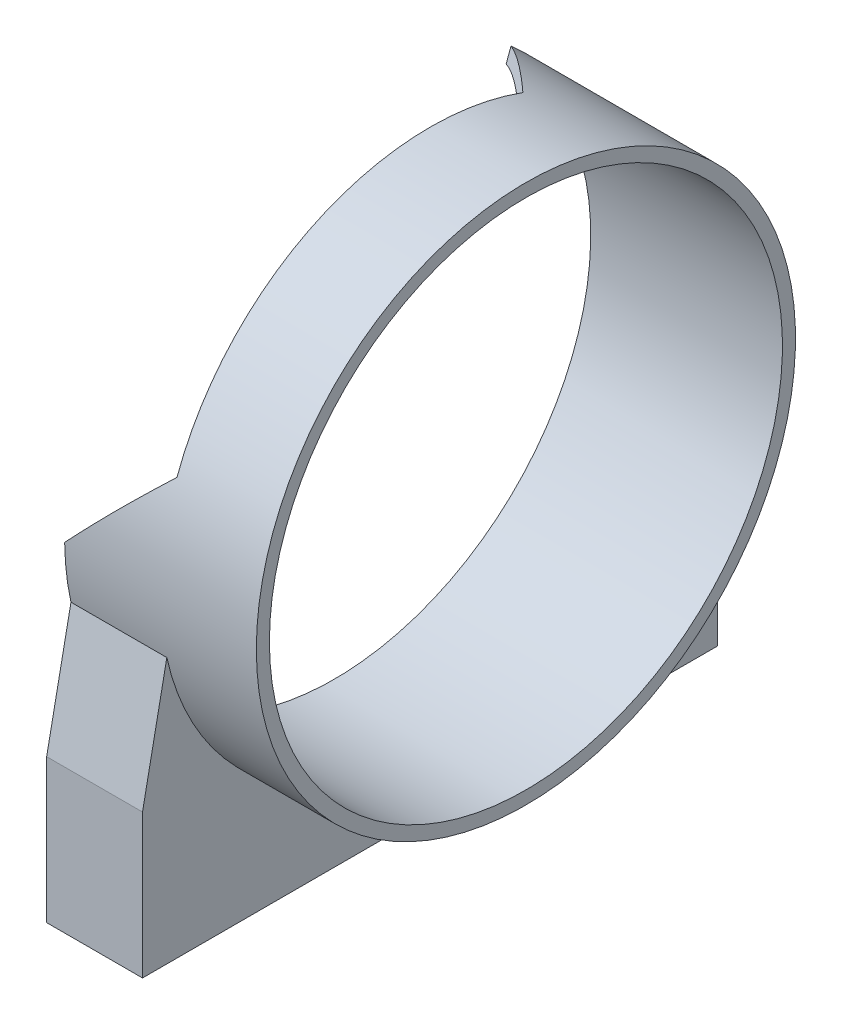
from build123d import *

# Parameters (mm, degrees)
EXTRUDE_1_DEPTH     = 8
MM_1_D              = 4
MM_1_DEPTH          = 12
MM_1_TIP            = 1.201721238
EXTRUDE_START       = -16
SKETCH_5_R          = 22.5
SKETCH_5_R_2        = 21.41
EXTRUDE_2_DEPTH     = 16
CUT_EXTRUDE_1_DEPTH = 8
CHAMFER_1_SIZE      = 8


with BuildPart() as part:
    # 草图1 → 凸台-拉伸1 (new body)
    with BuildSketch(Plane(origin=(0, 0, 0), x_dir=(0, 0, -1), z_dir=(1, 0, 0))):
        with BuildLine():
            Line((0, 0), (0, 5.59))
            ThreePointArc((0, 5.59), (-14.522523536, 11.268362763), (-21.34171621, 25.291418949))
            Line((-21.34171621, 25.291418949), (-24, 12))
            Line((-24, 12), (-24, 0))
            Line((-24, 0), (0, 0))
        make_face()
    extrude_1 = extrude(amount=-EXTRUDE_1_DEPTH)

    # 镜向1: 凸台-拉伸1 across plane
    add(extrude_1.mirror(Plane(origin=(0, 0, 0), x_dir=(1, 0, 0), z_dir=(0, 0, -1))))

    # 大小mm 暗销孔1
    with Locations(Plane(origin=(0, 0, 0), x_dir=(-1, 0, 0), z_dir=(0, -1, 0))):
        with Locations((5, 21), (5, -21)):
            Hole(MM_1_D / 2, depth=MM_1_DEPTH)
            with Locations((0, 0, -(MM_1_DEPTH + MM_1_TIP / 2))):  # 118° drill point
                Cone(0, MM_1_D / 2, MM_1_TIP, mode=Mode.SUBTRACT)

    # 草图5 → 凸台-拉伸2 (add)
    with BuildSketch(Plane.ZY.offset(8).offset(EXTRUDE_START)):
        with Locations((0, 27)):
            Circle(SKETCH_5_R)
        with Locations(Location((0, 27, 0), (0, 0, 180))):
            Circle(SKETCH_5_R_2, mode=Mode.SUBTRACT)
    extrude(amount=EXTRUDE_2_DEPTH)

    # 草图6 → 切除-拉伸1 (cut)
    with BuildSketch(Plane.ZY.offset(8)):
        Polygon((0, 27), (-12.808653102, 61.912636137), (29.307523189, 37.752264491), align=None)
    extrude(amount=-CUT_EXTRUDE_1_DEPTH, mode=Mode.SUBTRACT)

    # 倒角1
    # the kernel refuses this chamfer: 8 mm, written as the material it takes off along each edge
    with BuildSketch(Plane(origin=(-8, 41.835747499, 40.437901637), x_dir=(-0.027495876610586258, -0.938457441934671, 0.3442987168823741), z_dir=(0, -0.3444289396397119, -0.9388123910231819))) as chamfer_1_piece_1_section:
        Polygon((CHAMFER_1_SIZE * 0.999621916911, -CHAMFER_1_SIZE * 0.0274958766106), (-CHAMFER_1_SIZE * 0.0274958766106, -CHAMFER_1_SIZE * 0.999621916911), (0, 0), align=None)
    chamfer_1_piece_1 = extrude(amount=42.236927807, mode=Mode.PRIVATE)
    chamfer_1_piece_1 = split(chamfer_1_piece_1, bisect_by=Plane(origin=(0, 32.080437257, 21.522032065), z_dir=(-1, 0, 0)), keep=Keep.TOP, mode=Mode.PRIVATE)
    add(chamfer_1_piece_1, mode=Mode.SUBTRACT)
    with BuildSketch(Plane(origin=(-8, 27.785350453, -0.288127241), x_dir=(-0.02749587661058627, -0.34429871688237407, -0.9384574419346708), z_dir=(0, 0.9388123910231819, -0.34442893963971194))) as chamfer_1_piece_2_section:
        Polygon((CHAMFER_1_SIZE * 0.999621916911, -CHAMFER_1_SIZE * 0.0274958766106), (-CHAMFER_1_SIZE * 0.0274958766106, -CHAMFER_1_SIZE * 0.999621916911), (0, 0), align=None)
    chamfer_1_piece_2 = extrude(amount=42.236927807, mode=Mode.PRIVATE)
    chamfer_1_piece_2 = split(chamfer_1_piece_2, bisect_by=Plane(origin=(0, 46.701220025, -10.043437483), z_dir=(-1, 0, 0)), keep=Keep.TOP, mode=Mode.PRIVATE)
    add(chamfer_1_piece_2, mode=Mode.SUBTRACT)


solid = part.part
